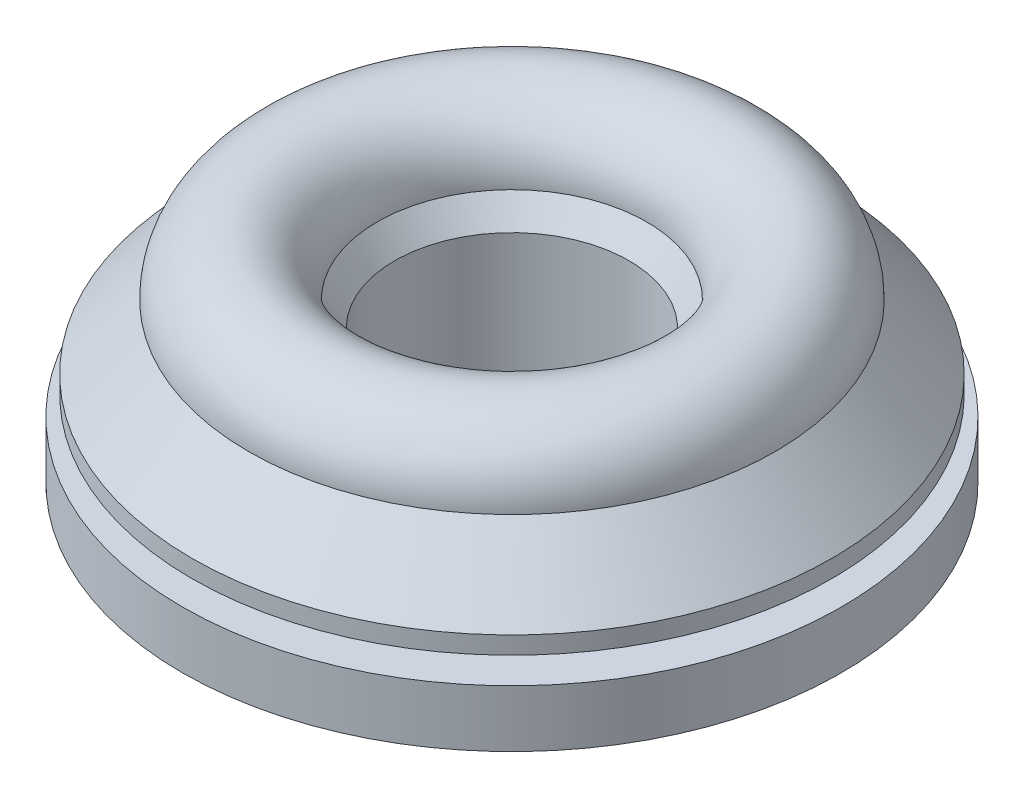
from build123d import *


with BuildPart() as part:
    # Sketch1 → Revolve1 (revolve)
    with BuildSketch(Plane.XY):
        with BuildLine():
            Line((8.763, 5.9563), (7.62, 4.3434))
            Line((7.62, 4.3434), (7.62, -4.3434))
            Line((7.62, -4.3434), (21.43125, -4.3434))
            Line((21.43125, -4.3434), (21.43125, -0.635))
            Line((21.43125, -0.635), (17.4625, -0.635))
            Line((17.4625, -0.635), (17.4625, 0.635))
            Line((17.4625, 0.635), (20.79625, 0.635))
            Line((20.79625, 0.635), (20.79625, 1.778))
            Line((20.79625, 1.778), (17.1196, 5.9563))
            ThreePointArc((17.1196, 5.9563), (12.9413, 10.1346), (8.763, 5.9563))
        make_face()
    revolve(axis=Axis((0, 10.1346, 0), (0, -1, 0)))


solid = part.part
